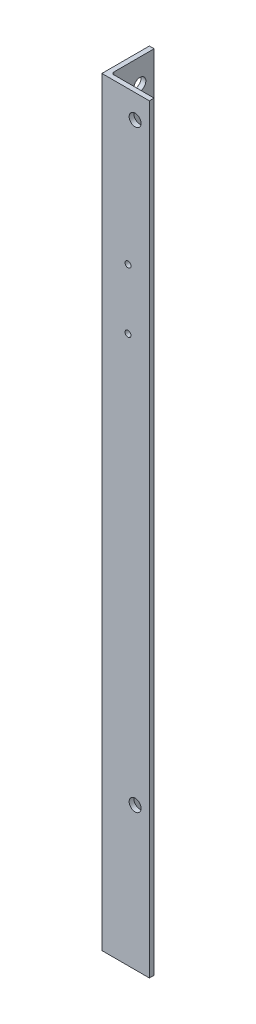
from build123d import *

# Parameters (mm, degrees)
BOSS_EXTRUDE1_DEPTH               = 508
FRONTSIDEHOLES_SKETCH3_R          = 4
FRONTSIDEHOLES_SKETCH3_R_2        = 2
FRONTSIDEHOLES_CUT_EXTRUDE1_DEPTH = 3.175
LEFTSIDEHOLES_SKETCH4_R           = 4
LEFTSIDEHOLES_CUT_EXTRUDE2_DEPTH  = 3.175


with BuildPart() as part:
    # Sketch2 → Boss-Extrude1 (new body)
    with BuildSketch(Plane(origin=(0, 0, 0), x_dir=(1, 0, 0), z_dir=(0, 1, 0))):
        with BuildLine():
            Line((0, 31.75), (3.175, 31.75))
            Line((3.175, 31.75), (3.175, 4.7625))
            ThreePointArc((3.175, 4.7625), (3.639967985, 3.639967985), (4.7625, 3.175))
            Line((4.7625, 3.175), (31.75, 3.175))
            Line((31.75, 3.175), (31.75, 0))
            Line((31.75, 0), (0, 0))
            Line((0, 0), (0, 31.75))
        make_face()
    extrude(amount=BOSS_EXTRUDE1_DEPTH)

    # FrontSideHoles-Sketch3 → FrontSideHoles-Cut-Extrude1 (cut)
    with BuildSketch(Plane.XY):
        with Locations((22.225, 95.4)):
            Circle(FRONTSIDEHOLES_SKETCH3_R)
        with Locations((22.225, 492.125)):
            Circle(FRONTSIDEHOLES_SKETCH3_R)
        with Locations((17.4625, 406.13487)):
            Circle(FRONTSIDEHOLES_SKETCH3_R_2)
        with Locations((17.4625, 365.93487)):
            Circle(FRONTSIDEHOLES_SKETCH3_R_2)
    extrude(amount=-FRONTSIDEHOLES_CUT_EXTRUDE1_DEPTH, mode=Mode.SUBTRACT)

    # LeftSideHoles-Sketch4 → LeftSideHoles-Cut-Extrude2 (cut)
    with BuildSketch(Plane.ZY):
        with Locations((-22.225, 95.4)):
            Circle(LEFTSIDEHOLES_SKETCH4_R)
        with Locations((-22.225, 492.125)):
            Circle(LEFTSIDEHOLES_SKETCH4_R)
        with Locations((-22.225, 351.58487)):
            Circle(LEFTSIDEHOLES_SKETCH4_R)
    extrude(amount=-LEFTSIDEHOLES_CUT_EXTRUDE2_DEPTH, mode=Mode.SUBTRACT)


solid = part.part
